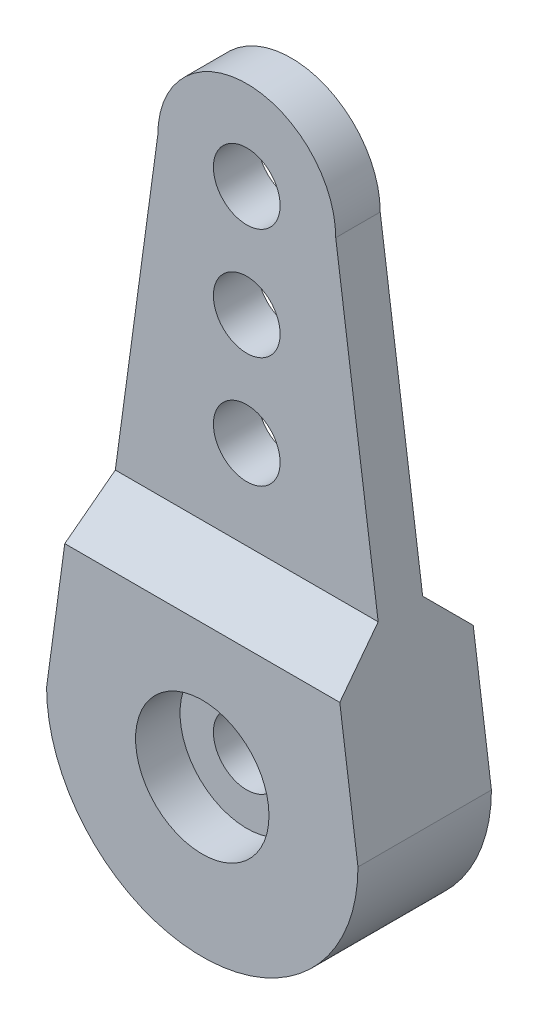
from build123d import *

# Parameters (mm, degrees)
BOSS_EXTRUDE1_DEPTH = 1
SKETCH2_R           = 3
BOSS_EXTRUDE2_DEPTH = 3
CHAMFER1_SIZE       = 2
SKETCH3_R           = 1.5
CUT_EXTRUDE1_DEPTH  = 28.221315178
SKETCH4_R           = 1.5
CUT_EXTRUDE2_DEPTH  = 28.221315178


with BuildPart() as part:
    # Sketch1 → Boss-Extrude1 (new, symmetric)
    with BuildSketch(Plane.XY):
        with BuildLine():
            Line((-7, 0), (-4, 22))
            ThreePointArc((-4, 22), (0, 26), (4, 22))
            Line((4, 22), (7, 0))
            ThreePointArc((7, 0), (0, -7), (-7, 0))
        make_face()
    extrude(amount=BOSS_EXTRUDE1_DEPTH, both=True)

    # Sketch2 → Boss-Extrude2 (add, symmetric)
    with BuildSketch(Plane.XY):
        with BuildLine():
            Line((-5.909090909, 8), (5.909090909, 8))
            Line((5.909090909, 8), (7, 0))
            ThreePointArc((7, 0), (0, -7), (-7, 0))
            Line((-7, 0), (-5.909090909, 8))
        make_face()
        Circle(SKETCH2_R, mode=Mode.SUBTRACT)
    extrude(amount=BOSS_EXTRUDE2_DEPTH, both=True)

    # Chamfer1
    chamfer1_edges = [part.edges().sort_by_distance(p)[0] for p in [
        (0, 8, -3),
        (0, 8, 3),
    ]]
    chamfer(chamfer1_edges, length=CHAMFER1_SIZE - 0.0001)  # a hair under: the kernel refuses the full size

    # Sketch3 → Cut-Extrude1 (cut, through all)
    with BuildSketch(Plane.XY.offset(1)):
        with Locations((0, 22)):
            Circle(SKETCH3_R)
        with Locations((0, 17)):
            Circle(SKETCH3_R)
        with Locations((0, 12)):
            Circle(SKETCH3_R)
    extrude(amount=-CUT_EXTRUDE1_DEPTH, mode=Mode.SUBTRACT)

    # Sketch4 → Cut-Extrude2 (cut, through all)
    with BuildSketch(Plane.XY.offset(1)):
        Circle(SKETCH4_R)
    extrude(amount=-CUT_EXTRUDE2_DEPTH, mode=Mode.SUBTRACT)


solid = part.part
